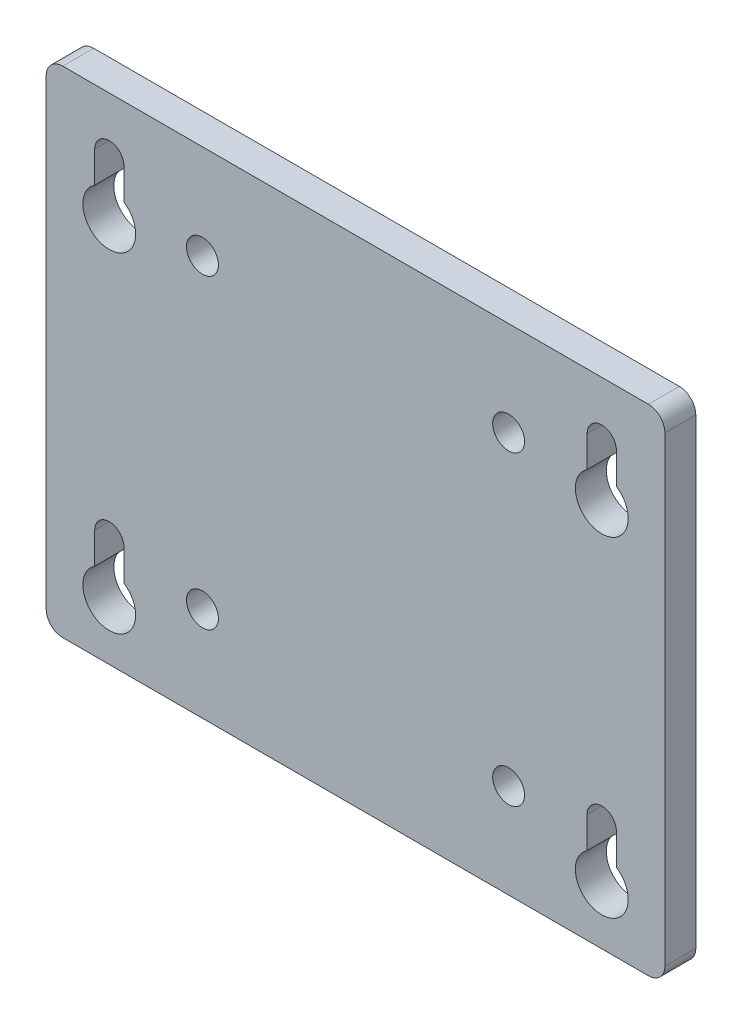
from build123d import *

# Parameters (mm, degrees)
SKETCH1_W                 = 95.25
SKETCH1_H                 = 76.2
BOSS_EXTRUDE1_DEPTH       = 4.7625
F_8_CLEARANCE_HOLE1_D     = 4.9149
FILLET1_R                 = 2.54
F_8_CLEARANCE_SLOT1_DEPTH = 4.7625
SKETCH6_R                 = 4.064
CUT_EXTRUDE1_DEPTH        = 62.175420156


# Read off the part's stored shape, not the designer's step: #8 Clearance Slot1
with BuildPart() as part:
    # Sketch1 → Boss-Extrude1 (new body)
    with BuildSketch(Plane.XY):
        Rectangle(SKETCH1_W, SKETCH1_H)
    extrude(amount=BOSS_EXTRUDE1_DEPTH)

    # #8 Clearance Hole1 (through all)
    with Locations(Plane.XY.offset(4.7625)):
        with Locations((23.57, 23.57), (-23.57, 23.57), (-23.57, -23.57), (23.57, -23.57)):
            Hole(F_8_CLEARANCE_HOLE1_D / 2)

    # Fillet1
    fillet1_edges = [part.edges().sort_by_distance(p)[0] for p in [
        (-47.625, 38.1, 2.38125),
        (47.625, 38.1, 2.38125),
        (47.625, -38.1, 2.38125),
        (-47.625, -38.1, 2.38125),
    ]]
    fillet(fillet1_edges, radius=FILLET1_R)

    # #8 Clearance Slot1 outline → #8 Clearance Slot1 (cut)
    with BuildSketch(Plane.XY):
        with BuildLine():
            ThreePointArc((-40.1604, 21.2979), (-37.9125, 19.05), (-35.6646, 21.2979))
            Line((-35.6646, 21.2979), (-35.6646, 29.5021))
            ThreePointArc((-35.6646, 29.5021), (-37.9125, 31.75), (-40.1604, 29.5021))
            Line((-40.1604, 29.5021), (-40.1604, 21.2979))
        make_face()
        with BuildLine():
            ThreePointArc((-35.6646, -21.2979), (-37.9125, -19.05), (-40.1604, -21.2979))
            Line((-40.1604, -21.2979), (-40.1604, -29.5021))
            ThreePointArc((-40.1604, -29.5021), (-37.9125, -31.75), (-35.6646, -29.5021))
            Line((-35.6646, -29.5021), (-35.6646, -21.2979))
        make_face()
        with BuildLine():
            ThreePointArc((35.6646, -29.5021), (37.9125, -31.75), (40.1604, -29.5021))
            Line((40.1604, -29.5021), (40.1604, -21.2979))
            ThreePointArc((40.1604, -21.2979), (37.9125, -19.05), (35.6646, -21.2979))
            Line((35.6646, -21.2979), (35.6646, -29.5021))
        make_face()
        with BuildLine():
            ThreePointArc((40.1604, 29.5021), (37.9125, 31.75), (35.6646, 29.5021))
            Line((35.6646, 29.5021), (35.6646, 21.2979))
            ThreePointArc((35.6646, 21.2979), (37.9125, 19.05), (40.1604, 21.2979))
            Line((40.1604, 21.2979), (40.1604, 29.5021))
        make_face()
    extrude(amount=F_8_CLEARANCE_SLOT1_DEPTH, mode=Mode.SUBTRACT)

    # Sketch6 → Cut-Extrude1 (cut, through all)
    with BuildSketch(Plane(origin=(0, 0, 0), x_dir=(-1, 0, 0), z_dir=(0, 0, -1))):
        with Locations((-37.9125, 21.2979)):
            Circle(SKETCH6_R)
        with Locations((-37.9125, -29.5021)):
            Circle(SKETCH6_R)
        with Locations((37.9125, -29.5021)):
            Circle(SKETCH6_R)
        with Locations((37.9125, 21.2979)):
            Circle(SKETCH6_R)
    extrude(amount=-CUT_EXTRUDE1_DEPTH, mode=Mode.SUBTRACT)


solid = part.part
